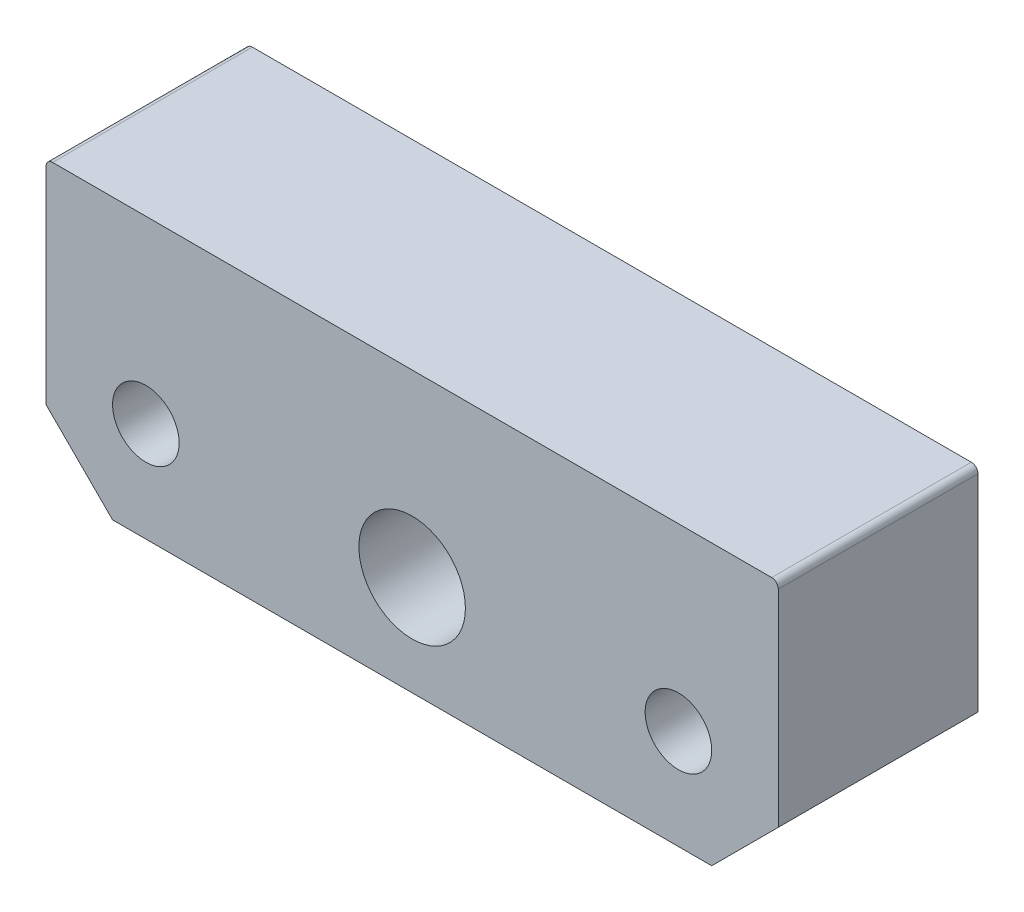
from build123d import *

# Parameters (mm, degrees)
CROQUIS1_W              = 110
CROQUIS1_H              = 42
SALIENTE_EXTRUIR1_DEPTH = 30
CHAFL_N1_SIZE           = 10
REDONDEO1_R             = 1
CROQUIS2_R              = 5
CROQUIS2_R_2            = 8
CORTAR_EXTRUIR1_DEPTH   = 30


with BuildPart() as part:
    # Croquis1 → Saliente-Extruir1 (new body)
    with BuildSketch(Plane.XY):
        Rectangle(CROQUIS1_W, CROQUIS1_H)
    extrude(amount=SALIENTE_EXTRUIR1_DEPTH)

    # Chaflán1
    chafl_n1_edges = [part.edges().sort_by_distance(p)[0] for p in [
        (-55, -21, 15),
        (55, -21, 15),
    ]]
    chamfer(chafl_n1_edges, length=CHAFL_N1_SIZE)

    # Redondeo1
    redondeo1_edges = [part.edges().sort_by_distance(p)[0] for p in [
        (-55, 21, 15),
        (55, 21, 15),
    ]]
    fillet(redondeo1_edges, radius=REDONDEO1_R)

    # Croquis2 → Cortar-Extruir1 (cut)
    with BuildSketch(Plane.XY.offset(30)):
        with Locations((-40, -6)):
            Circle(CROQUIS2_R)
        with Locations((40, -6)):
            Circle(CROQUIS2_R)
        with Locations((0, -6)):
            Circle(CROQUIS2_R_2)
    extrude(amount=-CORTAR_EXTRUIR1_DEPTH, mode=Mode.SUBTRACT)


solid = part.part
